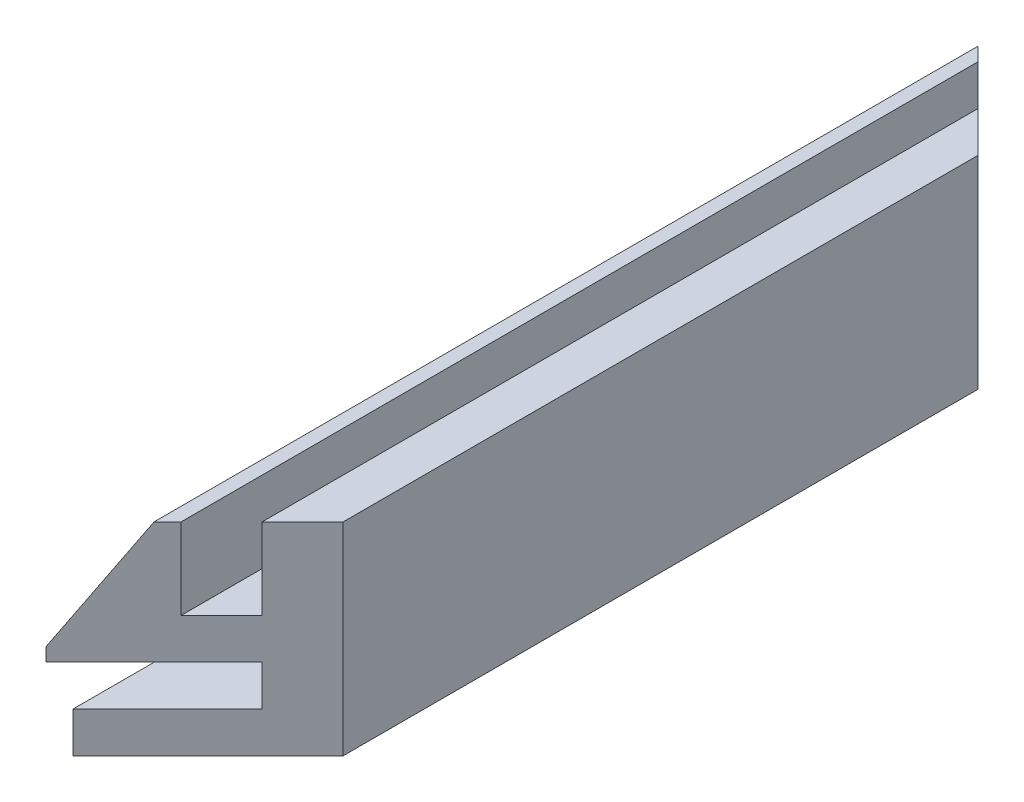
from build123d import *

# Parameters (mm, degrees)
DODANIE_WYCI_GNI_CIE1_DEPTH = 70
WYTNIJ_WYCI_GNI_CIE1_DEPTH  = 47


with BuildPart() as part:
    # Szkic1 → Dodanie-wyciągnięcie1 (new body)
    with BuildSketch(Plane.XY):
        Polygon((0, 0), (-7, 0), (-7, -3), (-0.506849315, -3), (3, -3), (3, 12), (0, 12), (0, 6), (-3, 6), (-3, 12), (-4, 12), (-8, 4), (-8, 3), (0, 3), align=None)
    extrude(amount=DODANIE_WYCI_GNI_CIE1_DEPTH)

    # Szkic2 → Wytnij-wyciągnięcie1 (cut)
    with BuildSketch(Plane(origin=(0, 12, 0), x_dir=(1, 0, 0), z_dir=(0, 1, 0))):
        Polygon((3, -12), (-8, -1), (-8, 0), (-4, 0), (-3, 0), (0, 0), (3, 0), align=None)
        Polygon((3, -59), (-8, -70), (-4, -70), (-3, -70), (0, -70), (3, -70), align=None)
    extrude(amount=-WYTNIJ_WYCI_GNI_CIE1_DEPTH, mode=Mode.SUBTRACT)


solid = part.part
